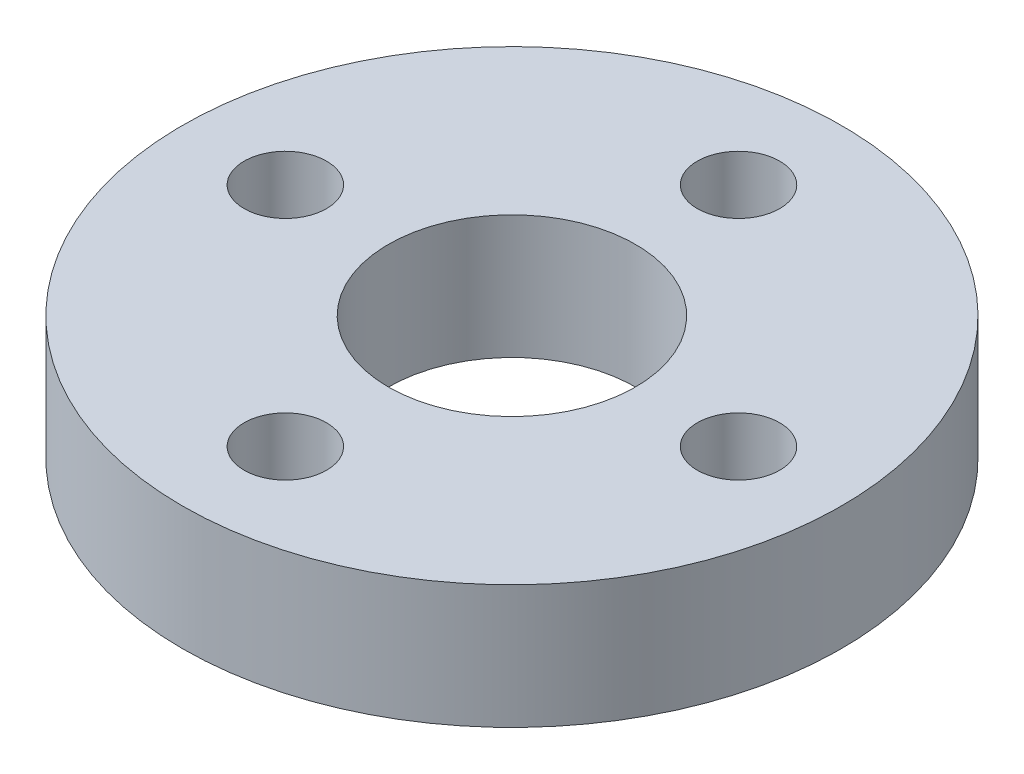
from build123d import *

# Parameters (mm, degrees)
SKETCH1_R           = 8
SKETCH1_R_2         = 3
SKETCH1_R_3         = 1
BOSS_EXTRUDE1_DEPTH = 3


with BuildPart() as part:
    # Sketch1 → Boss-Extrude1 (new body)
    with BuildSketch(Plane(origin=(0, 0, 0), x_dir=(1, 0, 0), z_dir=(0, 1, 0))):
        Circle(SKETCH1_R)
        Circle(SKETCH1_R_2, mode=Mode.SUBTRACT)
        with Locations((0, 5.5)):
            Circle(SKETCH1_R_3, mode=Mode.SUBTRACT)
        with Locations((5.5, 0)):
            Circle(SKETCH1_R_3, mode=Mode.SUBTRACT)
        with Locations((0, -5.5)):
            Circle(SKETCH1_R_3, mode=Mode.SUBTRACT)
        with Locations((-5.5, 0)):
            Circle(SKETCH1_R_3, mode=Mode.SUBTRACT)
    extrude(amount=BOSS_EXTRUDE1_DEPTH)


solid = part.part
